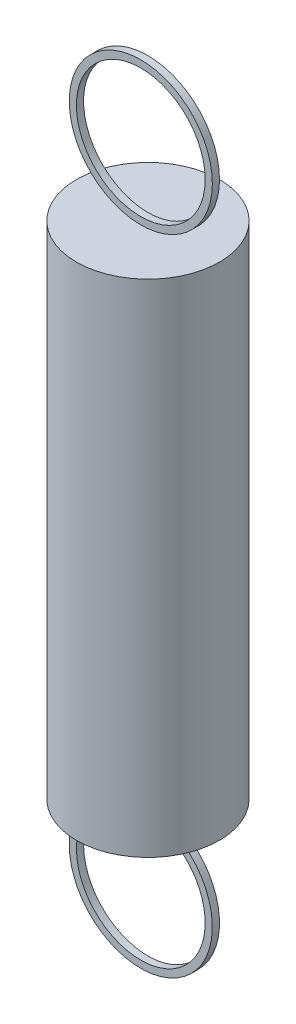
from build123d import *

# Parameters (mm, degrees)
SKETCH1_R             = 5
BOSS_EXTRUDE1_DEPTH   = 35
SKETCH3_R             = 5
SKETCH3_R_2           = 4.5
BOSS_EXTRUDE2_DEPTH   = 0.5
BOSS_EXTRUDE2_2_DEPTH = 0.5


with BuildPart() as part:
    # Sketch1 → Boss-Extrude1 (new body)
    with BuildSketch(Plane(origin=(0, 0, 0), x_dir=(1, 0, 0), z_dir=(0, 1, 0))):
        Circle(SKETCH1_R)
    extrude(amount=BOSS_EXTRUDE1_DEPTH)


with BuildPart() as body_2:
    # Sketch3 → Boss-Extrude2 (new body)
    with BuildSketch(Plane.XY):
        with Locations((0, 40)):
            Circle(SKETCH3_R)
        with Locations((0, 40)):
            Circle(SKETCH3_R_2, mode=Mode.SUBTRACT)
    extrude(amount=BOSS_EXTRUDE2_DEPTH)


with BuildPart() as body_3:
    # Sketch3 → Boss-Extrude2 2 (new body)
    with BuildSketch(Plane.XY):
        with Locations((0, -5)):
            Circle(SKETCH3_R)
        with Locations((0, -5)):
            Circle(SKETCH3_R_2, mode=Mode.SUBTRACT)
    extrude(amount=BOSS_EXTRUDE2_2_DEPTH)


solid = Compound([part.part, body_2.part, body_3.part])
